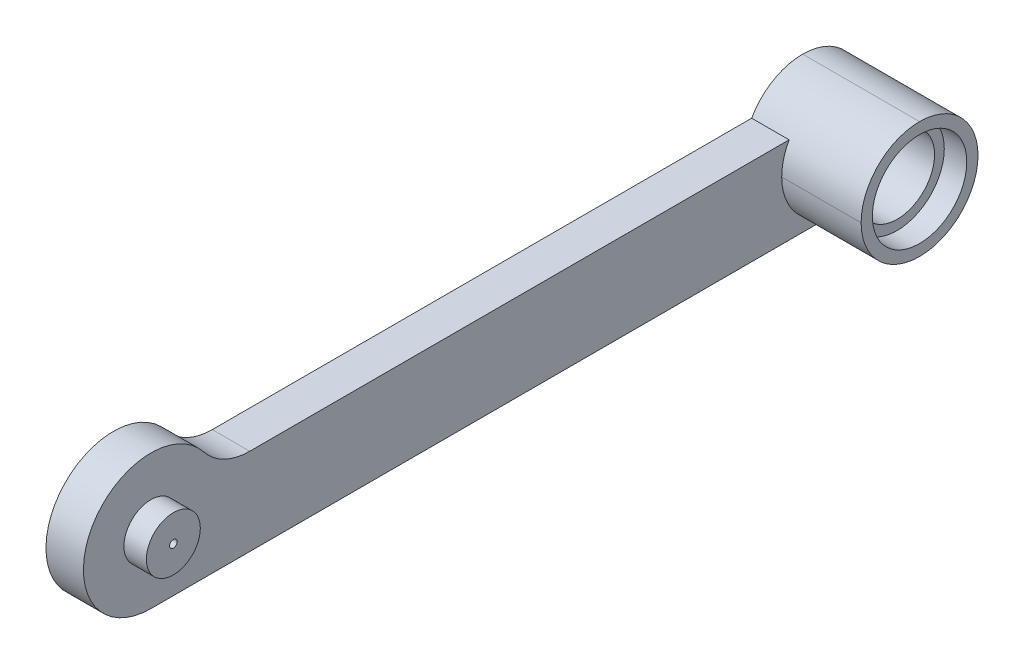
from build123d import *

# Parameters (mm, degrees)
SKETCH_1_R               = 4.5
SKETCH_1_W               = 49.9
SKETCH_1_H               = 7.8
EXTRUDE_1_DEPTH          = 2.5
EXTRUDE_START            = 2.5
SKETCH_1_6_R             = 1.8
SKETCH_1_6_R_2           = 0.25
EXTRUDE_3_DEPTH          = 1.5
SKETCH_1_5_W             = 7.8
SKETCH_1_5_H             = 7.8
EXTRUDE_2_DEPTH          = 7.8
SKETCH_1_7_R             = 2.5
CUT_EXTRUDE_1_DEPTH      = 51.706015422
SKETCH_1_8_R             = 3.15
SKETCH_1_8_R_2           = 2.5
CUT_EXTRUDE_2_DEPTH      = 1.5
CUT_EXTRUDE_START        = 6.3
SKETCH_1_9_R             = 3.15
SKETCH_1_9_R_2           = 2.5
CUT_EXTRUDE_3_DEPTH      = 1.5
SKETCH_2_W               = 0.191868154
SKETCH_2_H               = 2
SKETCH_2_W_2             = 37.6
CUT_EXTRUDE_4_DEPTH      = 51.706015422
FILLET_1_R               = 3.9
CUT_EXTRUDE_5_DEPTH      = 52.59021225
CUT_EXTRUDE_5_DEPTH_BACK = 52.59021225
SKETCH_3_W               = 77.270537225
SKETCH_3_H               = 10.975298688


with BuildPart() as part:
    # 草图1 → 凸台-拉伸1 (new body)
    with BuildSketch(Plane(origin=(0, 0, 0), x_dir=(0, 0, -1), z_dir=(1, 0, 0))):
        Circle(SKETCH_1_R)
        with Locations((24.95, -0.6)):
            Rectangle(SKETCH_1_W, SKETCH_1_H)
    extrude(amount=EXTRUDE_1_DEPTH)

    # 草图1<6> → 凸台-拉伸3 (add)
    with BuildSketch(Plane(origin=(0, 0, 0), x_dir=(0, 0, -1), z_dir=(1, 0, 0)).offset(EXTRUDE_START)):
        Circle(SKETCH_1_6_R)
        Circle(SKETCH_1_6_R_2, mode=Mode.SUBTRACT)
    extrude(amount=EXTRUDE_3_DEPTH)

    # 草图1<5> → 凸台-拉伸2 (add)
    with BuildSketch(Plane(origin=(0, 0, 0), x_dir=(0, 0, -1), z_dir=(1, 0, 0))):
        with Locations((46, -0.6)):
            Rectangle(SKETCH_1_5_W, SKETCH_1_5_H)
    extrude(amount=EXTRUDE_2_DEPTH)

    # 草图1<7> → 切除-拉伸1 (cut, through all)
    with BuildSketch(Plane(origin=(0, 0, 0), x_dir=(0, 0, -1), z_dir=(1, 0, 0))):
        with Locations((46, -0.6)):
            Circle(SKETCH_1_7_R)
    extrude(amount=CUT_EXTRUDE_1_DEPTH, mode=Mode.SUBTRACT)

    # 草图1<8> → 切除-拉伸2 (cut)
    with BuildSketch(Plane(origin=(0, 0, 0), x_dir=(0, 0, -1), z_dir=(1, 0, 0))):
        with Locations((46, -0.6)):
            Circle(SKETCH_1_8_R)
        with Locations((46, -0.6)):
            Circle(SKETCH_1_8_R_2, mode=Mode.SUBTRACT)
    extrude(amount=CUT_EXTRUDE_2_DEPTH, mode=Mode.SUBTRACT)

    # 草图1<9> → 切除-拉伸3 (cut)
    with BuildSketch(Plane(origin=(0, 0, 0), x_dir=(0, 0, -1), z_dir=(1, 0, 0)).offset(CUT_EXTRUDE_START)):
        with Locations((46, -0.6)):
            Circle(SKETCH_1_9_R)
        with Locations((46, -0.6)):
            Circle(SKETCH_1_9_R_2, mode=Mode.SUBTRACT)
    extrude(amount=CUT_EXTRUDE_3_DEPTH, mode=Mode.SUBTRACT)

    # 草图2 → 切除-拉伸4 (cut, through all)
    with BuildSketch(Plane.ZY):
        with BuildLine():
            Line((-3.059411708, 3.3), (-4.308131846, 3.3))
            Line((-4.308131846, 3.3), (-4.308131846, 1.3))
            ThreePointArc((-4.308131846, 1.3), (-3.817089795, 2.383238447), (-3.059411708, 3.3))
        make_face()
        with Locations((-4.404065923, 2.3)):
            Rectangle(SKETCH_2_W, SKETCH_2_H)
        with Locations((-23.3, 2.3)):
            Rectangle(SKETCH_2_W_2, SKETCH_2_H)
    extrude(amount=-CUT_EXTRUDE_4_DEPTH, mode=Mode.SUBTRACT)

    # 圆角1
    fillet_1_edges = [part.edges().sort_by_distance(p)[0] for p in [
        (1.25, 1.3, -4.308131846),
    ]]
    fillet(fillet_1_edges, radius=FILLET_1_R)
    fillet_1_2_edges = [part.edges().sort_by_distance(p)[0] for p in [
        (3.9, -4.5, -49.9),
        (3.9, 3.3, -49.9),
        (5.15, -4.5, -42.1),
        (3.9, 3.3, -42.1),
    ]]
    fillet(fillet_1_2_edges, radius=FILLET_1_R - 0.0001)  # a hair under: the kernel refuses the full size


with BuildPart() as body_2:
    # 镜向2: mirrored copy
    add(part.part.mirror(Plane.ZY.offset(1)))

    # 草图3 → 切除-拉伸5 (cut, two sides: drawn at the far end of the back side and taken through both)
    with BuildSketch(Plane(origin=(-4.5, 0, 0), x_dir=(0, 0, 1), z_dir=(0, -1, 0)).offset(-CUT_EXTRUDE_5_DEPTH_BACK)):
        with Locations((-16.91889565, 1.946720459)):
            Rectangle(SKETCH_3_W, SKETCH_3_H)
    extrude(amount=CUT_EXTRUDE_5_DEPTH + CUT_EXTRUDE_5_DEPTH_BACK, mode=Mode.SUBTRACT)


solid = part.part
